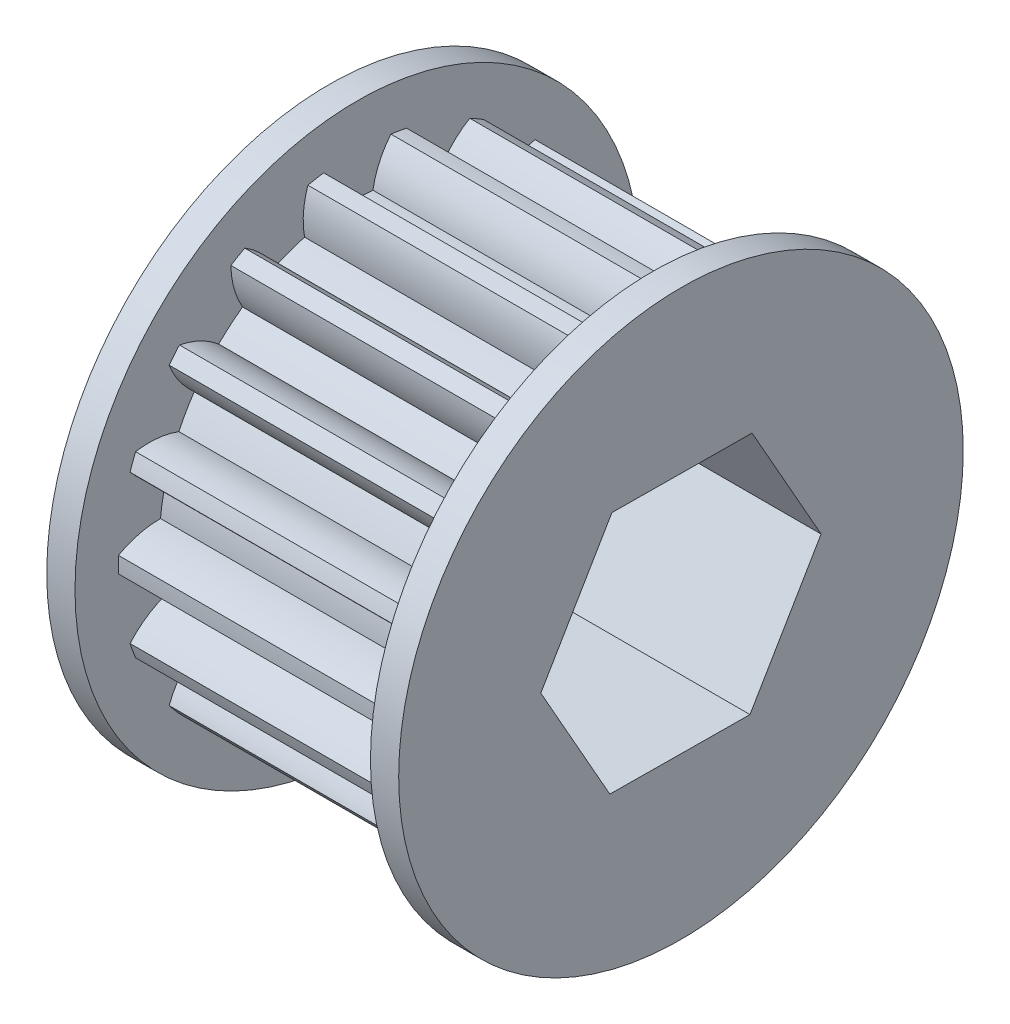
from build123d import *

# Parameters (mm, degrees)
BOSS_EXTRUDE1_DEPTH      = 4
BOSS_EXTRUDE1_DEPTH_BACK = 13.2
SKETCH2_R                = 15
SKETCH2_R_2              = 7.854644271
BOSS_EXTRUDE2_DEPTH      = 1.5
SKETCH3_R                = 15
SKETCH3_R_2              = 9.60106287
BOSS_EXTRUDE3_DEPTH      = 1.5
BOSS_EXTRUDE4_DEPTH      = 1.5
BOSS_EXTRUDE4_DEPTH_BACK = 16.7
SKETCH5_R                = 10.503090292
CUT_EXTRUDE1_DEPTH       = 29.278790639


# Read off the part's stored shape, not the designer's step: am-4212 18T 20DP 500hex 375 FW.STEP<1>
with BuildPart() as part:
    # Sketch1 → Boss-Extrude1 (new, two sides: drawn at the far end of the back side and taken through both)
    # profile 1 of 19: a face of its own
    with BuildSketch(Plane(origin=(11.1125, 0, 0), x_dir=(0, 0, -1), z_dir=(1, 0, 0)).offset(-BOSS_EXTRUDE1_DEPTH_BACK)):
        with BuildLine():
            ThreePointArc((-12.692845514, 0.426230867), (-12.7, 0), (-12.692845514, -0.426230867))
            ThreePointArc((-12.692845514, -0.426230867), (-12.311027604, -0.61546759), (-11.913249275, -0.768333072))
            ThreePointArc((-11.913249275, -0.768333072), (-11.938, 0), (-11.913249275, 0.768333072))
            ThreePointArc((-11.913249275, 0.768333072), (-12.311027604, 0.61546759), (-12.692845514, 0.426230867))
        make_face()
    # profile 2 of 19: a face of its own
    with BuildSketch(Plane(origin=(11.1125, 0, 0), x_dir=(0, 0, -1), z_dir=(1, 0, 0)).offset(-BOSS_EXTRUDE1_DEPTH_BACK)):
        with BuildLine():
            ThreePointArc((-11.913249275, 0.768333072), (-11.938, 0), (-11.913249275, -0.768333072))
            ThreePointArc((-11.913249275, -0.768333072), (-10.87193442, -0.983463934), (-9.809087715, -0.952242218))
            ThreePointArc((-9.809087715, -0.952242218), (-9.705477367, -1.711337521), (-9.543213362, -2.4600906))
            ThreePointArc((-9.543213362, -2.4600906), (-10.552641024, -2.794266767), (-11.457577821, -3.352574307))
            ThreePointArc((-11.457577821, -3.352574307), (-11.218050507, -4.083036471), (-10.932007046, -4.796568142))
            ThreePointArc((-10.932007046, -4.796568142), (-9.879912073, -4.64257437), (-8.891841322, -4.249720572))
            ThreePointArc((-8.891841322, -4.249720572), (-8.534853559, -4.9276), (-8.126286635, -5.575700185))
            ThreePointArc((-8.126286635, -5.575700185), (-8.96054338, -6.234967657), (-9.619953385, -7.069111745))
            ThreePointArc((-9.619953385, -7.069111745), (-9.145038562, -7.673598484), (-8.632203428, -8.246266305))
            ThreePointArc((-8.632203428, -8.246266305), (-7.696226517, -7.74172182), (-6.902107637, -7.034619905))
            ThreePointArc((-6.902107637, -7.034619905), (-6.334800451, -7.549521196), (-5.729209809, -8.01879804))
            ThreePointArc((-5.729209809, -8.01879804), (-6.287671961, -8.923639429), (-6.622020596, -9.933009978))
            ThreePointArc((-6.622020596, -9.933009978), (-5.969, -10.33861127), (-5.291228679, -10.70134305))
            ThreePointArc((-5.291228679, -10.70134305), (-4.58426246, -9.907103363), (-4.079877906, -8.971040258))
            ThreePointArc((-4.079877906, -8.971040258), (-3.370676917, -9.260858716), (-2.641105726, -9.494710506))
            ThreePointArc((-2.641105726, -9.494710506), (-2.856414507, -10.535988587), (-2.825374393, -11.598840612))
            ThreePointArc((-2.825374393, -11.598840612), (-2.073011945, -11.756634955), (-1.312053661, -11.865679887))
            ThreePointArc((-1.312053661, -11.865679887), (-0.919368693, -10.877542027), (-0.765554687, -9.825420757))
            ThreePointArc((-0.765554687, -9.825420757), (0, -9.8552), (0.765554687, -9.825420757))
            ThreePointArc((0.765554687, -9.825420757), (0.919368693, -10.877542027), (1.312053661, -11.865679887))
            ThreePointArc((1.312053661, -11.865679887), (2.073011945, -11.756634955), (2.825374393, -11.598840612))
            ThreePointArc((2.825374393, -11.598840612), (2.856414507, -10.535988587), (2.641105726, -9.494710506))
            ThreePointArc((2.641105726, -9.494710506), (3.370676917, -9.260858716), (4.079877906, -8.971040258))
            ThreePointArc((4.079877906, -8.971040258), (4.58426246, -9.907103363), (5.291228679, -10.70134305))
            ThreePointArc((5.291228679, -10.70134305), (5.969, -10.33861127), (6.622020596, -9.933009978))
            ThreePointArc((6.622020596, -9.933009978), (6.287671961, -8.923639429), (5.729209809, -8.01879804))
            ThreePointArc((5.729209809, -8.01879804), (6.334800451, -7.549521196), (6.902107637, -7.034619905))
            ThreePointArc((6.902107637, -7.034619905), (7.696226517, -7.74172182), (8.632203428, -8.246266305))
            ThreePointArc((8.632203428, -8.246266305), (9.145038562, -7.673598484), (9.619953385, -7.069111745))
            ThreePointArc((9.619953385, -7.069111745), (8.96054338, -6.234967657), (8.126286635, -5.575700185))
            ThreePointArc((8.126286635, -5.575700185), (8.534853559, -4.9276), (8.891841322, -4.249720572))
            ThreePointArc((8.891841322, -4.249720572), (9.879912073, -4.64257437), (10.932007046, -4.796568142))
            ThreePointArc((10.932007046, -4.796568142), (11.218050507, -4.083036471), (11.457577821, -3.352574307))
            ThreePointArc((11.457577821, -3.352574307), (10.552641024, -2.794266767), (9.543213362, -2.4600906))
            ThreePointArc((9.543213362, -2.4600906), (9.705477367, -1.711337521), (9.809087715, -0.952242218))
            ThreePointArc((9.809087715, -0.952242218), (10.87193442, -0.983463934), (11.913249275, -0.768333072))
            ThreePointArc((11.913249275, -0.768333072), (11.938, 0), (11.913249275, 0.768333072))
            ThreePointArc((11.913249275, 0.768333072), (10.87193442, 0.983463934), (9.809087715, 0.952242218))
            ThreePointArc((9.809087715, 0.952242218), (9.705477367, 1.711337521), (9.543213362, 2.4600906))
            ThreePointArc((9.543213362, 2.4600906), (10.552641024, 2.794266767), (11.457577821, 3.352574307))
            ThreePointArc((11.457577821, 3.352574307), (11.218050507, 4.083036471), (10.932007046, 4.796568142))
            ThreePointArc((10.932007046, 4.796568142), (9.879912073, 4.64257437), (8.891841322, 4.249720572))
            ThreePointArc((8.891841322, 4.249720572), (8.534853559, 4.9276), (8.126286635, 5.575700185))
            ThreePointArc((8.126286635, 5.575700185), (8.96054338, 6.234967657), (9.619953385, 7.069111745))
            ThreePointArc((9.619953385, 7.069111745), (9.145038562, 7.673598484), (8.632203428, 8.246266305))
            ThreePointArc((8.632203428, 8.246266305), (7.696226517, 7.74172182), (6.902107637, 7.034619905))
            ThreePointArc((6.902107637, 7.034619905), (6.334800451, 7.549521196), (5.729209809, 8.01879804))
            ThreePointArc((5.729209809, 8.01879804), (6.287671961, 8.923639429), (6.622020596, 9.933009978))
            ThreePointArc((6.622020596, 9.933009978), (5.969, 10.33861127), (5.291228679, 10.70134305))
            ThreePointArc((5.291228679, 10.70134305), (4.58426246, 9.907103363), (4.079877906, 8.971040258))
            ThreePointArc((4.079877906, 8.971040258), (3.370676917, 9.260858716), (2.641105726, 9.494710506))
            ThreePointArc((2.641105726, 9.494710506), (2.856414507, 10.535988587), (2.825374393, 11.598840612))
            ThreePointArc((2.825374393, 11.598840612), (2.073011945, 11.756634955), (1.312053661, 11.865679887))
            ThreePointArc((1.312053661, 11.865679887), (0.919368693, 10.877542027), (0.765554687, 9.825420757))
            ThreePointArc((0.765554687, 9.825420757), (0, 9.8552), (-0.765554687, 9.825420757))
            ThreePointArc((-0.765554687, 9.825420757), (-0.919368693, 10.877542027), (-1.312053661, 11.865679887))
            ThreePointArc((-1.312053661, 11.865679887), (-2.073011945, 11.756634955), (-2.825374393, 11.598840612))
            ThreePointArc((-2.825374393, 11.598840612), (-2.856414507, 10.535988587), (-2.641105726, 9.494710506))
            ThreePointArc((-2.641105726, 9.494710506), (-3.370676917, 9.260858716), (-4.079877906, 8.971040258))
            ThreePointArc((-4.079877906, 8.971040258), (-4.58426246, 9.907103363), (-5.291228679, 10.70134305))
            ThreePointArc((-5.291228679, 10.70134305), (-5.969, 10.33861127), (-6.622020596, 9.933009978))
            ThreePointArc((-6.622020596, 9.933009978), (-6.287671961, 8.923639429), (-5.729209809, 8.01879804))
            ThreePointArc((-5.729209809, 8.01879804), (-6.334800451, 7.549521196), (-6.902107637, 7.034619905))
            ThreePointArc((-6.902107637, 7.034619905), (-7.696226517, 7.74172182), (-8.632203428, 8.246266305))
            ThreePointArc((-8.632203428, 8.246266305), (-9.145038562, 7.673598484), (-9.619953385, 7.069111745))
            ThreePointArc((-9.619953385, 7.069111745), (-8.96054338, 6.234967657), (-8.126286635, 5.575700185))
            ThreePointArc((-8.126286635, 5.575700185), (-8.534853559, 4.9276), (-8.891841322, 4.249720572))
            ThreePointArc((-8.891841322, 4.249720572), (-9.879912073, 4.64257437), (-10.932007046, 4.796568142))
            ThreePointArc((-10.932007046, 4.796568142), (-11.218050507, 4.083036471), (-11.457577821, 3.352574307))
            ThreePointArc((-11.457577821, 3.352574307), (-10.552641024, 2.794266767), (-9.543213362, 2.4600906))
            ThreePointArc((-9.543213362, 2.4600906), (-9.705477367, 1.711337521), (-9.809087715, 0.952242218))
            ThreePointArc((-9.809087715, 0.952242218), (-10.87193442, 0.983463934), (-11.913249275, 0.768333072))
        make_face()
        Polygon((-3.666174209, -6.35), (-7.332348419, 0), (-3.666174209, 6.35), (3.666174209, 6.35), (7.332348419, 0), (3.666174209, -6.35), align=None, mode=Mode.SUBTRACT)
    # profile 3 of 19: a face of its own
    with BuildSketch(Plane(origin=(11.1125, 0, 0), x_dir=(0, 0, -1), z_dir=(1, 0, 0)).offset(-BOSS_EXTRUDE1_DEPTH_BACK)):
        with BuildLine():
            ThreePointArc((-10.932007046, -4.796568142), (-11.218050507, -4.083036471), (-11.457577821, -3.352574307))
            ThreePointArc((-11.457577821, -3.352574307), (-11.779084107, -3.632269073), (-12.073152809, -3.940682842))
            ThreePointArc((-12.073152809, -3.940682842), (-11.934096284, -4.34365582), (-11.781593724, -4.741734842))
            ThreePointArc((-11.781593724, -4.741734842), (-11.35807948, -4.788969778), (-10.932007046, -4.796568142))
        make_face()
    # profile 4 of 19: a face of its own
    with BuildSketch(Plane(origin=(11.1125, 0, 0), x_dir=(0, 0, -1), z_dir=(1, 0, 0)).offset(-BOSS_EXTRUDE1_DEPTH_BACK)):
        with BuildLine():
            ThreePointArc((-12.073152809, 3.940682842), (-11.779084107, 3.632269073), (-11.457577821, 3.352574307))
            ThreePointArc((-11.457577821, 3.352574307), (-11.218050507, 4.083036471), (-10.932007046, 4.796568142))
            ThreePointArc((-10.932007046, 4.796568142), (-11.35807948, 4.788969778), (-11.781593724, 4.741734842))
            ThreePointArc((-11.781593724, 4.741734842), (-11.934096284, 4.34365582), (-12.073152809, 3.940682842))
        make_face()
    # profile 5 of 19: a face of its own
    with BuildSketch(Plane(origin=(11.1125, 0, 0), x_dir=(0, 0, -1), z_dir=(1, 0, 0)).offset(-BOSS_EXTRUDE1_DEPTH_BACK)):
        with BuildLine():
            ThreePointArc((-8.632203428, -8.246266305), (-9.145038562, -7.673598484), (-9.619953385, -7.069111745))
            ThreePointArc((-9.619953385, -7.069111745), (-9.826409226, -7.441900479), (-9.997259693, -7.832292041))
            ThreePointArc((-9.997259693, -7.832292041), (-9.728764428, -8.163402643), (-9.449307854, -8.485315615))
            ThreePointArc((-9.449307854, -8.485315615), (-9.035179344, -8.384851534), (-8.632203428, -8.246266305))
        make_face()
    # profile 6 of 19: a face of its own
    with BuildSketch(Plane(origin=(11.1125, 0, 0), x_dir=(0, 0, -1), z_dir=(1, 0, 0)).offset(-BOSS_EXTRUDE1_DEPTH_BACK)):
        with BuildLine():
            ThreePointArc((-9.997259693, 7.832292041), (-9.826409226, 7.441900479), (-9.619953385, 7.069111745))
            ThreePointArc((-9.619953385, 7.069111745), (-9.145038562, 7.673598484), (-8.632203428, 8.246266305))
            ThreePointArc((-8.632203428, 8.246266305), (-9.035179344, 8.384851534), (-9.449307854, 8.485315615))
            ThreePointArc((-9.449307854, 8.485315615), (-9.728764428, 8.163402643), (-9.997259693, 7.832292041))
        make_face()
    # profile 7 of 19: a face of its own
    with BuildSketch(Plane(origin=(11.1125, 0, 0), x_dir=(0, 0, -1), z_dir=(1, 0, 0)).offset(-BOSS_EXTRUDE1_DEPTH_BACK)):
        with BuildLine():
            ThreePointArc((-5.291228679, -10.70134305), (-5.969, -10.33861127), (-6.622020596, -9.933009978))
            ThreePointArc((-6.622020596, -9.933009978), (-6.68852437, -10.353928857), (-6.715549515, -10.779211228))
            ThreePointArc((-6.715549515, -10.779211228), (-6.35, -10.998522628), (-5.977295999, -11.205442095))
            ThreePointArc((-5.977295999, -11.205442095), (-5.622503234, -10.969396447), (-5.291228679, -10.70134305))
        make_face()
    # profile 8 of 19: a face of its own
    with BuildSketch(Plane(origin=(11.1125, 0, 0), x_dir=(0, 0, -1), z_dir=(1, 0, 0)).offset(-BOSS_EXTRUDE1_DEPTH_BACK)):
        with BuildLine():
            ThreePointArc((-6.715549515, 10.779211228), (-6.68852437, 10.353928857), (-6.622020596, 9.933009978))
            ThreePointArc((-6.622020596, 9.933009978), (-5.969, 10.33861127), (-5.291228679, 10.70134305))
            ThreePointArc((-5.291228679, 10.70134305), (-5.622503234, 10.969396447), (-5.977295999, 11.205442095))
            ThreePointArc((-5.977295999, 11.205442095), (-6.35, 10.998522628), (-6.715549515, 10.779211228))
        make_face()
    # profile 9 of 19: a face of its own
    with BuildSketch(Plane(origin=(11.1125, 0, 0), x_dir=(0, 0, -1), z_dir=(1, 0, 0)).offset(-BOSS_EXTRUDE1_DEPTH_BACK)):
        with BuildLine():
            ThreePointArc((-1.312053661, -11.865679887), (-2.073011945, -11.756634955), (-2.825374393, -11.598840612))
            ThreePointArc((-2.825374393, -11.598840612), (-2.743904763, -12.017120606), (-2.623844955, -12.425998457))
            ThreePointArc((-2.623844955, -12.425998457), (-2.205331856, -12.507058463), (-1.784334031, -12.574026883))
            ThreePointArc((-1.784334031, -12.574026883), (-1.531670254, -12.230870257), (-1.312053661, -11.865679887))
        make_face()
    # profile 10 of 19: a face of its own
    with BuildSketch(Plane(origin=(11.1125, 0, 0), x_dir=(0, 0, -1), z_dir=(1, 0, 0)).offset(-BOSS_EXTRUDE1_DEPTH_BACK)):
        with BuildLine():
            ThreePointArc((-2.623844955, 12.425998457), (-2.743904763, 12.017120606), (-2.825374393, 11.598840612))
            ThreePointArc((-2.825374393, 11.598840612), (-2.073011945, 11.756634955), (-1.312053661, 11.865679887))
            ThreePointArc((-1.312053661, 11.865679887), (-1.531670254, 12.230870257), (-1.784334031, 12.574026883))
            ThreePointArc((-1.784334031, 12.574026883), (-2.205331856, 12.507058463), (-2.623844955, 12.425998457))
        make_face()
    # profile 11 of 19: a face of its own
    with BuildSketch(Plane(origin=(11.1125, 0, 0), x_dir=(0, 0, -1), z_dir=(1, 0, 0)).offset(-BOSS_EXTRUDE1_DEPTH_BACK)):
        with BuildLine():
            ThreePointArc((2.825374393, -11.598840612), (2.073011945, -11.756634955), (1.312053661, -11.865679887))
            ThreePointArc((1.312053661, -11.865679887), (1.531670254, -12.230870257), (1.784334031, -12.574026883))
            ThreePointArc((1.784334031, -12.574026883), (2.205331856, -12.507058463), (2.623844955, -12.425998457))
            ThreePointArc((2.623844955, -12.425998457), (2.743904763, -12.017120606), (2.825374393, -11.598840612))
        make_face()
    # profile 12 of 19: a face of its own
    with BuildSketch(Plane(origin=(11.1125, 0, 0), x_dir=(0, 0, -1), z_dir=(1, 0, 0)).offset(-BOSS_EXTRUDE1_DEPTH_BACK)):
        with BuildLine():
            ThreePointArc((1.784334031, 12.574026883), (1.531670254, 12.230870257), (1.312053661, 11.865679887))
            ThreePointArc((1.312053661, 11.865679887), (2.073011945, 11.756634955), (2.825374393, 11.598840612))
            ThreePointArc((2.825374393, 11.598840612), (2.743904763, 12.017120606), (2.623844955, 12.425998457))
            ThreePointArc((2.623844955, 12.425998457), (2.205331856, 12.507058463), (1.784334031, 12.574026883))
        make_face()
    # profile 13 of 19: a face of its own
    with BuildSketch(Plane(origin=(11.1125, 0, 0), x_dir=(0, 0, -1), z_dir=(1, 0, 0)).offset(-BOSS_EXTRUDE1_DEPTH_BACK)):
        with BuildLine():
            ThreePointArc((6.622020596, -9.933009978), (5.969, -10.33861127), (5.291228679, -10.70134305))
            ThreePointArc((5.291228679, -10.70134305), (5.622503234, -10.969396447), (5.977295999, -11.205442095))
            ThreePointArc((5.977295999, -11.205442095), (6.35, -10.998522628), (6.715549515, -10.779211228))
            ThreePointArc((6.715549515, -10.779211228), (6.68852437, -10.353928857), (6.622020596, -9.933009978))
        make_face()
    # profile 14 of 19: a face of its own
    with BuildSketch(Plane(origin=(11.1125, 0, 0), x_dir=(0, 0, -1), z_dir=(1, 0, 0)).offset(-BOSS_EXTRUDE1_DEPTH_BACK)):
        with BuildLine():
            ThreePointArc((5.977295999, 11.205442095), (5.622503234, 10.969396447), (5.291228679, 10.70134305))
            ThreePointArc((5.291228679, 10.70134305), (5.969, 10.33861127), (6.622020596, 9.933009978))
            ThreePointArc((6.622020596, 9.933009978), (6.68852437, 10.353928857), (6.715549515, 10.779211228))
            ThreePointArc((6.715549515, 10.779211228), (6.35, 10.998522628), (5.977295999, 11.205442095))
        make_face()
    # profile 15 of 19: a face of its own
    with BuildSketch(Plane(origin=(11.1125, 0, 0), x_dir=(0, 0, -1), z_dir=(1, 0, 0)).offset(-BOSS_EXTRUDE1_DEPTH_BACK)):
        with BuildLine():
            ThreePointArc((9.619953385, -7.069111745), (9.145038562, -7.673598484), (8.632203428, -8.246266305))
            ThreePointArc((8.632203428, -8.246266305), (9.035179344, -8.384851534), (9.449307854, -8.485315615))
            ThreePointArc((9.449307854, -8.485315615), (9.728764428, -8.163402643), (9.997259693, -7.832292041))
            ThreePointArc((9.997259693, -7.832292041), (9.826409226, -7.441900479), (9.619953385, -7.069111745))
        make_face()
    # profile 16 of 19: a face of its own
    with BuildSketch(Plane(origin=(11.1125, 0, 0), x_dir=(0, 0, -1), z_dir=(1, 0, 0)).offset(-BOSS_EXTRUDE1_DEPTH_BACK)):
        with BuildLine():
            ThreePointArc((9.449307854, 8.485315615), (9.035179344, 8.384851534), (8.632203428, 8.246266305))
            ThreePointArc((8.632203428, 8.246266305), (9.145038562, 7.673598484), (9.619953385, 7.069111745))
            ThreePointArc((9.619953385, 7.069111745), (9.826409226, 7.441900479), (9.997259693, 7.832292041))
            ThreePointArc((9.997259693, 7.832292041), (9.728764428, 8.163402643), (9.449307854, 8.485315615))
        make_face()
    # profile 17 of 19: a face of its own
    with BuildSketch(Plane(origin=(11.1125, 0, 0), x_dir=(0, 0, -1), z_dir=(1, 0, 0)).offset(-BOSS_EXTRUDE1_DEPTH_BACK)):
        with BuildLine():
            ThreePointArc((11.457577821, -3.352574307), (11.218050507, -4.083036471), (10.932007046, -4.796568142))
            ThreePointArc((10.932007046, -4.796568142), (11.35807948, -4.788969778), (11.781593724, -4.741734842))
            ThreePointArc((11.781593724, -4.741734842), (11.934096284, -4.34365582), (12.073152809, -3.940682842))
            ThreePointArc((12.073152809, -3.940682842), (11.779084107, -3.632269073), (11.457577821, -3.352574307))
        make_face()
    # profile 18 of 19: a face of its own
    with BuildSketch(Plane(origin=(11.1125, 0, 0), x_dir=(0, 0, -1), z_dir=(1, 0, 0)).offset(-BOSS_EXTRUDE1_DEPTH_BACK)):
        with BuildLine():
            ThreePointArc((11.781593724, 4.741734842), (11.35807948, 4.788969778), (10.932007046, 4.796568142))
            ThreePointArc((10.932007046, 4.796568142), (11.218050507, 4.083036471), (11.457577821, 3.352574307))
            ThreePointArc((11.457577821, 3.352574307), (11.779084107, 3.632269073), (12.073152809, 3.940682842))
            ThreePointArc((12.073152809, 3.940682842), (11.934096284, 4.34365582), (11.781593724, 4.741734842))
        make_face()
    # profile 19 of 19: a face of its own
    with BuildSketch(Plane(origin=(11.1125, 0, 0), x_dir=(0, 0, -1), z_dir=(1, 0, 0)).offset(-BOSS_EXTRUDE1_DEPTH_BACK)):
        with BuildLine():
            ThreePointArc((11.913249275, 0.768333072), (11.938, 0), (11.913249275, -0.768333072))
            ThreePointArc((11.913249275, -0.768333072), (12.311027604, -0.61546759), (12.692845514, -0.426230867))
            ThreePointArc((12.692845514, -0.426230867), (12.7, 0), (12.692845514, 0.426230867))
            ThreePointArc((12.692845514, 0.426230867), (12.311027604, 0.61546759), (11.913249275, 0.768333072))
        make_face()
    extrude(amount=BOSS_EXTRUDE1_DEPTH + BOSS_EXTRUDE1_DEPTH_BACK)

    # Sketch2 → Boss-Extrude2 (add)
    with BuildSketch(Plane(origin=(15.1125, 0, 0), x_dir=(0, 0, -1), z_dir=(1, 0, 0))):
        Circle(SKETCH2_R)
        Circle(SKETCH2_R_2, mode=Mode.SUBTRACT)
    extrude(amount=BOSS_EXTRUDE2_DEPTH)

    # Sketch3 → Boss-Extrude3 (add)
    with BuildSketch(Plane.ZY.offset(2.0875)):
        with Locations(Location((0, 0, 0), (0, 0, 180))):
            Circle(SKETCH3_R)
        Circle(SKETCH3_R_2, mode=Mode.SUBTRACT)
    extrude(amount=-BOSS_EXTRUDE3_DEPTH)

    # Sketch5 → Boss-Extrude4 (add, two sides: drawn at the far end of the back side and taken through both)
    with BuildSketch(Plane(origin=(15.1125, 0, 0), x_dir=(0, 0, -1), z_dir=(1, 0, 0)).offset(-BOSS_EXTRUDE4_DEPTH_BACK)):
        Circle(SKETCH5_R)
    extrude(amount=BOSS_EXTRUDE4_DEPTH + BOSS_EXTRUDE4_DEPTH_BACK)

    # Sketch4 → Cut-Extrude1 (cut, through all)
    with BuildSketch(Plane(origin=(16.6125, 0, 0), x_dir=(0, 0, -1), z_dir=(1, 0, 0))):
        Polygon((3.669006525, -6.481388055), (7.44754997, -0.06324117), (3.778543445, 6.418146885), (-3.669006525, 6.481388055), (-7.44754997, 0.06324117), (-3.778543445, -6.418146885), align=None)
    extrude(amount=-CUT_EXTRUDE1_DEPTH, mode=Mode.SUBTRACT)


solid = part.part
